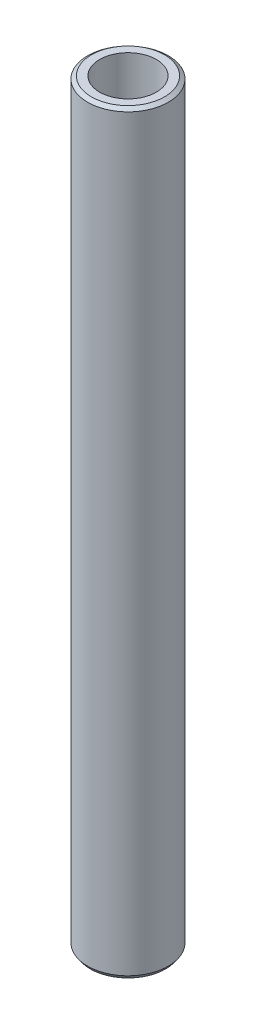
from build123d import *
from OCP.BRepFilletAPI import BRepFilletAPI_MakeChamfer

# Parameters (mm, degrees)
SKETCH1_R           = 12.5
BOSS_EXTRUDE1_DEPTH = 233.830443088
SKETCH2_R           = 8.787184636
CUT_EXTRUDE1_DEPTH  = 235.497710255
CHAMFER1_SIZE       = 0.843346192
CHAMFER1_SIZE2      = 1.187334604


with BuildPart() as part:
    # Sketch1 → Boss-Extrude1 (new body)
    with BuildSketch(Plane(origin=(0, 0, 0), x_dir=(1, 0, 0), z_dir=(0, 1, 0))):
        Circle(SKETCH1_R)
    extrude(amount=BOSS_EXTRUDE1_DEPTH)

    # Sketch2 → Cut-Extrude1 (cut, through all)
    with BuildSketch(Plane(origin=(0, 0, 0), x_dir=(1, 0, 0), z_dir=(0, 1, 0))):
        Circle(SKETCH2_R)
    extrude(amount=CUT_EXTRUDE1_DEPTH, mode=Mode.SUBTRACT)

    # Chamfer1: one chamfer whose edges measure the first distance from different faces: ONE call of the kernel's chamfer builder (chamfer() names one face for all edges)
    chamfer1_edges_1 = [part.edges().sort_by_distance(p)[0] for p in [
        (-12.5, 233.830443088, 0),
    ]]
    chamfer1_side_1 = [part.faces().sort_by_distance(p)[0] for p in [
        (-12.5, 116.915221544, 0),
    ]]
    chamfer1_edges_2 = [part.edges().sort_by_distance(p)[0] for p in [
        (-12.5, 0, 0),
    ]]
    chamfer1_side_2 = [part.faces().sort_by_distance(p)[0] for p in [
        (-12.146446609, 0, 0),
    ]]
    chamfer1 = BRepFilletAPI_MakeChamfer(part.part.solid().wrapped)
    for e in chamfer1_edges_1:
        chamfer1.Add(CHAMFER1_SIZE, CHAMFER1_SIZE2, e.wrapped, chamfer1_side_1[0].wrapped)  # the first distance lies on this face
    for e in chamfer1_edges_2:
        chamfer1.Add(CHAMFER1_SIZE, CHAMFER1_SIZE2, e.wrapped, chamfer1_side_2[0].wrapped)  # the first distance lies on this face
    add(Compound.cast(chamfer1.Shape()), mode=Mode.REPLACE)


solid = part.part
